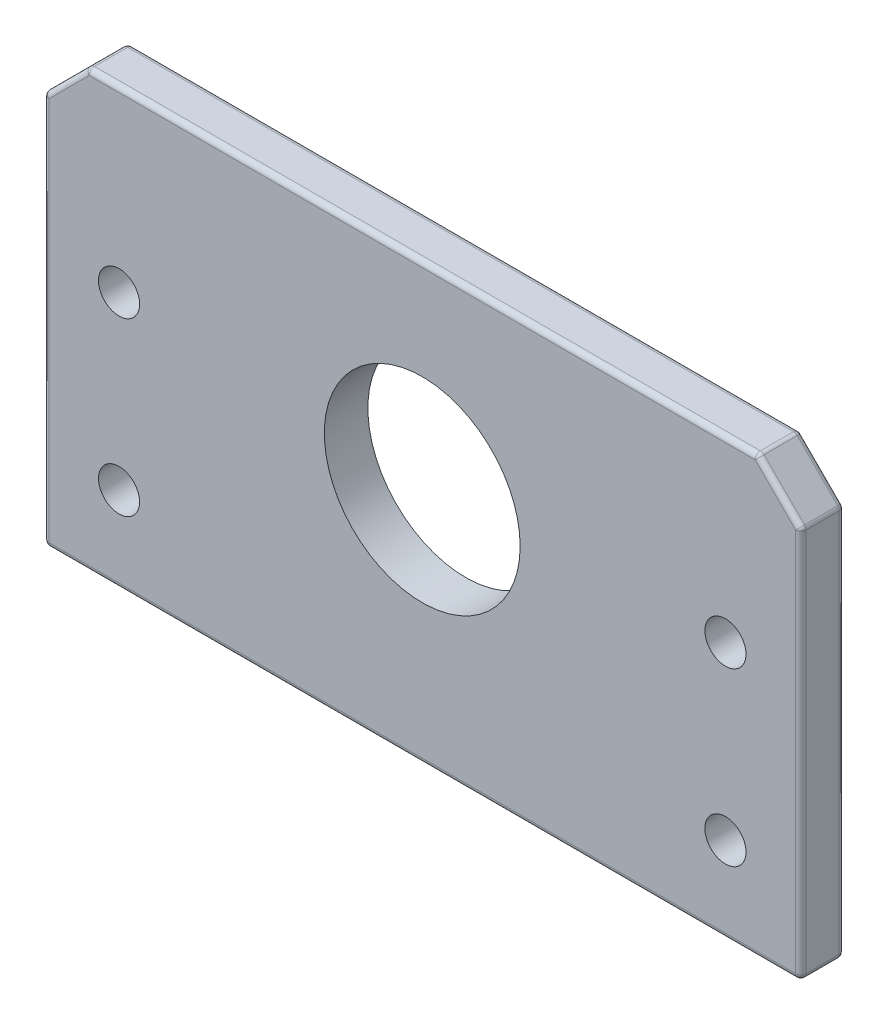
from build123d import *

# Parameters (mm, degrees)
SKETCH2_W                   = 110.49
SKETCH2_H                   = 6.35
BOSS_EXTRUDE1_DEPTH         = 63.5
SKETCH3_R                   = 14.2875
CUT_EXTRUDE1_DEPTH          = 85.407242136
CHAMFER1_SIZE               = 6.35
TAP_DRILL_FOR_M7X1_0_TAP1_D = 6
FILLET2_R                   = 0.762


with BuildPart() as part:
    # Sketch2 → Boss-Extrude1 (new body)
    with BuildSketch(Plane(origin=(0, 0, 0), x_dir=(1, 0, 0), z_dir=(0, 1, 0))):
        Rectangle(SKETCH2_W, SKETCH2_H)
    extrude(amount=-BOSS_EXTRUDE1_DEPTH)

    # Sketch3 → Cut-Extrude1 (cut, through all)
    with BuildSketch(Plane.XY.offset(3.175)):
        with Locations((0, -28.8150046)):
            Circle(SKETCH3_R)
    extrude(amount=-CUT_EXTRUDE1_DEPTH, mode=Mode.SUBTRACT)

    # Chamfer1
    chamfer1_edges = [part.edges().sort_by_distance(p)[0] for p in [
        (-55.245, 0, 0),
        (55.245, 0, 0),
    ]]
    chamfer(chamfer1_edges, length=CHAMFER1_SIZE)

    # Tap Drill for M7x1.0 Tap1 (through all)
    with Locations(Plane(origin=(0, 0, -3.175), x_dir=(-1, 0, 0), z_dir=(0, 0, -1))):
        with Locations((44.245, -26), (44.245, -51), (-44.245, -51), (-44.245, -26)):
            Hole(TAP_DRILL_FOR_M7X1_0_TAP1_D / 2)

    # Fillet2
    fillet2_edges = [part.edges().sort_by_distance(p)[0] for p in [
        (0, -63.5, 3.175),
        (0, -63.5, -3.175),
        (55.245, -63.5, 0),
        (55.245, -34.925, 3.175),
        (55.245, -34.925, -3.175),
        (52.07, -3.175, -3.175),
        (55.245, -6.35, 0),
        (52.07, -3.175, 3.175),
        (48.895, 0, 0),
        (0, 0, 3.175),
        (0, 0, -3.175),
        (-48.895, 0, 0),
        (-52.07, -3.175, 3.175),
        (-52.07, -3.175, -3.175),
        (-55.245, -63.5, 0),
        (-55.245, -34.925, -3.175),
        (-55.245, -6.35, 0),
        (-55.245, -34.925, 3.175),
    ]]
    fillet(fillet2_edges, radius=FILLET2_R)


solid = part.part
